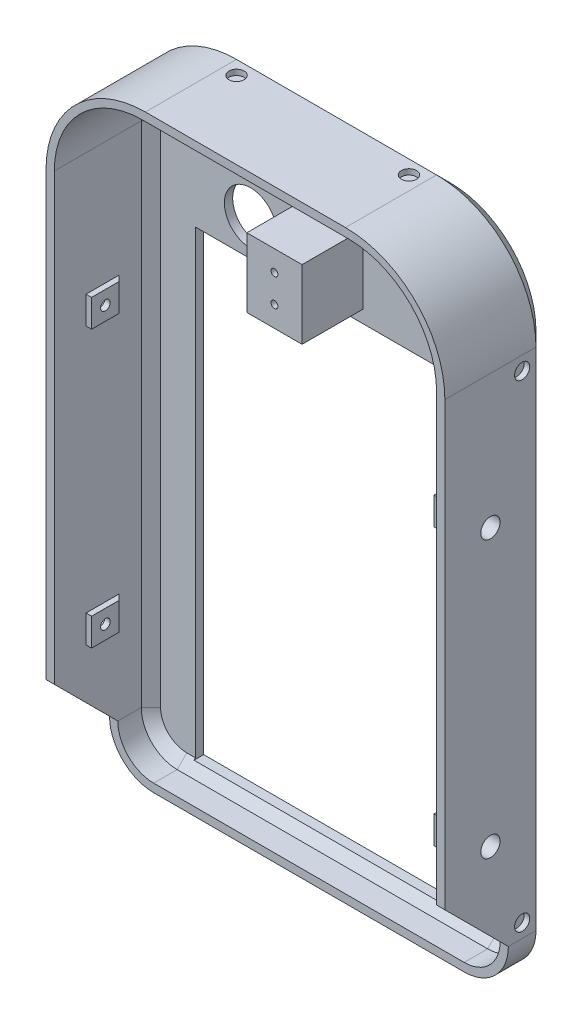
from build123d import *

# Parameters (mm, degrees)
ESQUISSE1_W                  = 20
ESQUISSE1_H                  = 25
BOSS_EXTRU_1_DEPTH           = 22
ESQUISSE2_R                  = 1.25
ENL_V_MAT_EXTRU_1_DEPTH      = 15
ESQUISSE3_W                  = 144.45
ESQUISSE3_H                  = 62
WALL_DEPTH                   = 3
CAMERAS_REACH                = 91.291
ESQUISSE4_R                  = 9.5
SCREEN_DEPTH                 = 3
ESQUISSE5_W                  = 144.45
ESQUISSE5_H                  = 235
ESQUISSE5_W_2                = 138.45
ESQUISSE5_H_2                = 229
BOSS_EXTRU_3_DEPTH           = 35
CONG_1_R                     = 32
CONG_2_R                     = 36
CONG_3_R                     = 13
CONG_4_R                     = 16
CHANFREIN1_SIZE              = 5
CHANFREIN2_SIZE              = 3.5
ENL_V_MAT_EXTRU_9_DEPTH      = 241.631456034
ESQUISSE11_W                 = 12.45
ESQUISSE11_H                 = 10
ESQUISSE11_W_2               = 2
BOSS_EXTRU_5_DEPTH           = 10
CHANFREIN3_SIZE              = 2
CHANFREIN4_SIZE              = 12.45
ENL_V_MAT_EXTRU_5_DEPTH      = 232.686631322
ENL_V_MAT_EXTRU_5_DEPTH_BACK = 232.686631322
ESQUISSE12_R                 = 1.75
ESQUISSE13_R                 = 3.5
ENL_V_MAT_EXTRU_6_DEPTH      = 3
ENL_V_START                  = -13.45
ESQUISSE14_R                 = 3.5
ENL_V_MAT_EXTRU_7_DEPTH      = 13.45
ESQUISSE6_R                  = 2.75
ENL_V_MAT_EXTRU_2_DEPTH      = 2
ESQUISSE7_R                  = 2.75
ENL_V_MAT_EXTRU_3_DEPTH      = 2
ENL_V_START_2                = -2
ESQUISSE8_R                  = 2.75
ENL_V_MAT_EXTRU_4_DEPTH      = 2
ESQUISSE15_R                 = 2.75
ENL_V_MAT_EXTRU_8_DEPTH      = 2


# Some blends are built 0.0001 mm under size
with BuildPart() as part:
    # Esquisse1 → Boss.-Extru.1 (new body)
    with BuildSketch(Plane.XY):
        with Locations((-2.234848485, 0.757575758)):
            Rectangle(ESQUISSE1_W, ESQUISSE1_H)
    extrude(amount=BOSS_EXTRU_1_DEPTH)

    # Esquisse2 → Enlèv. mat.-Extru.1 (cut)
    with BuildSketch(Plane.XY.offset(22)):
        with Locations((-2.234848485, 5.757575758)):
            Circle(ESQUISSE2_R)
        with Locations((-2.234848485, -4.242424242)):
            Circle(ESQUISSE2_R)
    extrude(amount=-ENL_V_MAT_EXTRU_1_DEPTH, mode=Mode.SUBTRACT)

    # Esquisse3 → Wall (add)
    with BuildSketch(Plane(origin=(0, 0, 0), x_dir=(-1, 0, 0), z_dir=(0, 0, -1))):
        with Locations((-0.260151515, 14.757575758)):
            Rectangle(ESQUISSE3_W, ESQUISSE3_H)
    extrude(amount=WALL_DEPTH)

    # Esquisse4 → Cameras (cut, up to next)
    with BuildSketch(Plane(origin=(0, 0, -3), x_dir=(-1, 0, 0), z_dir=(0, 0, -1)), mode=Mode.PRIVATE) as cameras_sk1:
        with Locations((32.869848485, -3.452132942)):
            Circle(ESQUISSE4_R)
    cameras_tool1 = extrude(cameras_sk1.sketch, amount=-CAMERAS_REACH, mode=Mode.PRIVATE) & part.part
    # Esquisse4 → Cameras (cut, up to next)
    with BuildSketch(Plane(origin=(0, 0, -3), x_dir=(-1, 0, 0), z_dir=(0, 0, -1)), mode=Mode.PRIVATE) as cameras_sk2:
        with BuildLine():
            Line((-32.535151515, 39.257575758), (32.464848485, 39.257575758))
            ThreePointArc((32.464848485, 39.257575758), (42.964848485, 28.757575758), (32.464848485, 18.257575758))
            Line((32.464848485, 18.257575758), (-32.535151515, 18.257575758))
            ThreePointArc((-32.535151515, 18.257575758), (-43.035151515, 28.757575758), (-32.535151515, 39.257575758))
        make_face()
    cameras_tool2 = extrude(cameras_sk2.sketch, amount=-CAMERAS_REACH, mode=Mode.PRIVATE) & part.part
    add(cameras_tool1.solids().sort_by_distance((-32.869848, -3.452133, -3))[0], mode=Mode.SUBTRACT)
    add(cameras_tool2.solids().sort_by_distance((0.035152, 28.757576, -3))[0], mode=Mode.SUBTRACT)

    # Esquisse9 → Screen (add)
    with BuildSketch(Plane(origin=(0, 0, -3), x_dir=(-1, 0, 0), z_dir=(0, 0, -1))):
        Polygon((-49.135151515, -183.242424242), (52.864848485, -183.242424242), (52.864848485, -16.242424242), (71.964848485, -16.242424242), (71.964848485, -189.242424242), (-72.485151515, -189.242424242), (-72.485151515, -16.242424242), (-49.135151515, -16.242424242), align=None)
    extrude(amount=-SCREEN_DEPTH)

    # Esquisse5 → Boss.-Extru.3 (add)
    with BuildSketch(Plane.XY):
        with Locations((0.260151515, -71.742424242)):
            Rectangle(ESQUISSE5_W, ESQUISSE5_H)
        with Locations((0.260151515, -71.742424242)):
            Rectangle(ESQUISSE5_W_2, ESQUISSE5_H_2, mode=Mode.SUBTRACT)
    extrude(amount=BOSS_EXTRU_3_DEPTH)

    # Congé1
    cong_1_edges = [part.edges().sort_by_distance(p)[0] for p in [
        (-68.964848485, 42.757575758, 17.5),
        (69.485151515, 42.757575758, 17.5),
    ]]
    fillet(cong_1_edges, radius=CONG_1_R)

    # Congé2
    cong_2_edges = [part.edges().sort_by_distance(p)[0] for p in [
        (-71.964848485, 45.757575758, 16),
        (72.485151515, 45.757575758, 16),
    ]]
    fillet(cong_2_edges, radius=CONG_2_R)

    # Congé3
    cong_3_edges = [part.edges().sort_by_distance(p)[0] for p in [
        (69.485151515, -186.242424242, 17.5),
        (-68.964848485, -186.242424242, 17.5),
    ]]
    fillet(cong_3_edges, radius=CONG_3_R)

    # Congé4
    cong_4_edges = [part.edges().sort_by_distance(p)[0] for p in [
        (72.485151515, -189.242424242, 16),
        (-71.964848485, -189.242424242, 16),
    ]]
    fillet(cong_4_edges, radius=CONG_4_R)

    # Chanfrein1
    chanfrein1_edges = [part.edges().sort_by_distance(p)[0] for p in [
        (0.260151515, 45.757575758, -3),
        (72.485151515, -81.742424242, -3),
        (61.940995638, 35.21341988, -3),
        (-61.420692608, 35.21341988, -3),
        (0.260151515, -189.242424242, -3),
        (-71.964848485, -81.742424242, -3),
        (67.798860014, -184.556132741, -3),
        (-67.278556984, -184.556132741, -3),
    ]]
    chamfer(chanfrein1_edges, length=CHANFREIN1_SIZE)

    # Chanfrein2
    # the kernel refuses this chamfer: 3.5 mm, written as the material it adds along each edge
    with BuildSketch(Plane(origin=(-68.964848485, 10.757575758, 0), x_dir=(-0.02749587661058612, 0, 0.9996219169112968), z_dir=(0, -1, 0)), Plane(origin=(69.485151515, -173.242424242, 0), x_dir=(0.02749587661058612, 0, 0.9996219169112968), z_dir=(0, 1, 0))) as chanfrein2_piece_1:
        Polygon((CHANFREIN2_SIZE * 0.999621916911, -CHANFREIN2_SIZE * 0.0274958766106), (-CHANFREIN2_SIZE * 0.0274958766106, -CHANFREIN2_SIZE * 0.999621916911), (0, 0), align=None)
    extrude(amount=184)
    with BuildSketch(Plane(origin=(-36.964848485, 10.757575758, 0), x_dir=(0, 1, 0), z_dir=(1, 0, 0))) as chanfrein2_piece_2:
        Polygon((32, CHANFREIN2_SIZE), (32 - CHANFREIN2_SIZE, 0), (32, 0), align=None)
    revolve(axis=Axis((-36.964848485, 10.757575758, 0), (0, 0, 1)), revolution_arc=90)
    with BuildSketch(Plane(origin=(37.485151515, 42.757575758, 0), x_dir=(0, 0.02749587661058612, 0.9996219169112968), z_dir=(-1, 0, 0))) as chanfrein2_piece_3:
        Polygon((CHANFREIN2_SIZE * 0.999621916911, -CHANFREIN2_SIZE * 0.0274958766106), (-CHANFREIN2_SIZE * 0.0274958766106, -CHANFREIN2_SIZE * 0.999621916911), (0, 0), align=None)
    extrude(amount=74.45)
    with BuildSketch(Plane(origin=(37.485151515, 10.757575758, 0), x_dir=(1, 0, 0), z_dir=(0, -1, 0))) as chanfrein2_piece_4:
        Polygon((32, CHANFREIN2_SIZE), (32 - CHANFREIN2_SIZE, 0), (32, 0), align=None)
    revolve(axis=Axis((37.485151515, 10.757575758, 0), (0, 0, 1)), revolution_arc=90)
    with BuildSketch(Plane(origin=(-55.964848485, -173.242424242, 0), x_dir=(-1, 0, 0), z_dir=(0, 1, 0))) as chanfrein2_piece_5:
        Polygon((13, CHANFREIN2_SIZE), (13 - CHANFREIN2_SIZE, 0), (13, 0), align=None)
    revolve(axis=Axis((-55.964848485, -173.242424242, 0), (0, 0, 1)), revolution_arc=90)
    with BuildSketch(Plane(origin=(-55.964848485, -186.242424242, 0), x_dir=(0, -0.027495876610590064, 0.9996219169112966), z_dir=(1, 0, 0))) as chanfrein2_piece_6_section:
        Polygon((CHANFREIN2_SIZE * 0.999621916911, -CHANFREIN2_SIZE * 0.0274958766106), (-CHANFREIN2_SIZE * 0.0274958766106, -CHANFREIN2_SIZE * 0.999621916911), (0, 0), align=None)
    chanfrein2_piece_6 = extrude(amount=112.45, mode=Mode.PRIVATE)
    chanfrein2_piece_6 = split(chanfrein2_piece_6, bisect_by=Plane(origin=(-53.646167158, -183.242424242, 1.694983129), z_dir=(0, -1, 0)), keep=Keep.TOP, mode=Mode.PRIVATE)
    add(chanfrein2_piece_6)
    with BuildSketch(Plane(origin=(-55.964848485, -186.242424242, 0), x_dir=(0, -0.027495876610590064, 0.9996219169112966), z_dir=(1, 0, 0))) as chanfrein2_piece_7_section:
        Polygon((CHANFREIN2_SIZE * 0.999621916911, -CHANFREIN2_SIZE * 0.0274958766106), (-CHANFREIN2_SIZE * 0.0274958766106, -CHANFREIN2_SIZE * 0.999621916911), (0, 0), align=None)
    chanfrein2_piece_7 = extrude(amount=112.45, mode=Mode.PRIVATE)
    chanfrein2_piece_7 = split(chanfrein2_piece_7, bisect_by=Plane(origin=(-52.864848485, -183.075757576, 0.166666667), z_dir=(-1, 0, 0)), keep=Keep.TOP, mode=Mode.PRIVATE)
    add(chanfrein2_piece_7)
    with BuildSketch(Plane(origin=(-55.964848485, -186.242424242, 0), x_dir=(0, -0.027495876610590064, 0.9996219169112966), z_dir=(1, 0, 0))) as chanfrein2_piece_8_section:
        Polygon((CHANFREIN2_SIZE * 0.999621916911, -CHANFREIN2_SIZE * 0.0274958766106), (-CHANFREIN2_SIZE * 0.0274958766106, -CHANFREIN2_SIZE * 0.999621916911), (0, 0), align=None)
    chanfrein2_piece_8 = extrude(amount=112.45, mode=Mode.PRIVATE)
    chanfrein2_piece_8 = split(chanfrein2_piece_8, bisect_by=Plane(origin=(49.135151515, -183.075757576, 0.166666667), z_dir=(1, 0, 0)), keep=Keep.TOP, mode=Mode.PRIVATE)
    add(chanfrein2_piece_8)
    with BuildSketch(Plane(origin=(56.485151515, -173.242424242, 0), x_dir=(0, -1, 0), z_dir=(-1, 0, 0))) as chanfrein2_piece_9:
        Polygon((13, CHANFREIN2_SIZE), (13 - CHANFREIN2_SIZE, 0), (13, 0), align=None)
    revolve(axis=Axis((56.485151515, -173.242424242, 0), (0, 0, 1)), revolution_arc=90)

    # Esquisse16 → Enlèv. mat.-Extru.9 (cut, through all)
    with BuildSketch(Plane(origin=(72.485151515, 0, 0), x_dir=(0, 0, -1), z_dir=(1, 0, 0))):
        Polygon((-35, -150.242424242), (-12, -173.242424242), (-12, -189.242424242), (-35, -189.242424242), align=None)
    extrude(amount=-ENL_V_MAT_EXTRU_9_DEPTH, mode=Mode.SUBTRACT)

    # Esquisse11 → Boss.-Extru.5 (add)
    with BuildSketch(Plane.XY.offset(13.5)):
        with Locations((63.260151515, -138.631356632)):
            Rectangle(ESQUISSE11_W, ESQUISSE11_H)
        with Locations((63.260151515, -38.631356632)):
            Rectangle(ESQUISSE11_W, ESQUISSE11_H)
        with Locations((-67.964848485, -138.631356632)):
            Rectangle(ESQUISSE11_W_2, ESQUISSE11_H)
        with Locations((-67.964848485, -38.631356632)):
            Rectangle(ESQUISSE11_W_2, ESQUISSE11_H)
    extrude(amount=BOSS_EXTRU_5_DEPTH)

    # Chanfrein3
    chanfrein3_edges = [part.edges().sort_by_distance(p)[0] for p in [
        (-68.964848485, -38.631356632, 13.5),
        (-68.964848485, -138.631356632, 13.5),
    ]]
    chamfer(chanfrein3_edges, length=CHANFREIN3_SIZE - 0.0001)  # a hair under: the kernel refuses the full size

    # Chanfrein4
    # the kernel refuses this chamfer: 12.45 mm, written as the material it adds along each edge
    with BuildSketch(Plane(origin=(69.485151515, -43.631356632, 13.5), x_dir=(0.027495876610586834, 0, -0.9996219169112968), z_dir=(0, 1, 0))) as chanfrein4_piece_1_section:
        Polygon((CHANFREIN4_SIZE * 0.999621916911, CHANFREIN4_SIZE * 0.0274958766106), (-CHANFREIN4_SIZE * 0.0274958766106, CHANFREIN4_SIZE * 0.999621916911), (0, 0), align=None)
    chanfrein4_piece_1 = extrude(amount=10, mode=Mode.PRIVATE)
    chanfrein4_piece_1 = split(chanfrein4_piece_1, bisect_by=Plane(origin=(57.035151515, -38.631356632, 9.386468279), z_dir=(1, 0, 0)), keep=Keep.TOP, mode=Mode.PRIVATE)
    add(chanfrein4_piece_1)
    with BuildSketch(Plane(origin=(69.485151515, -133.631356632, 13.5), x_dir=(0.027495876610586834, 0, -0.9996219169112968), z_dir=(0, -1, 0))) as chanfrein4_piece_2_section:
        Polygon((CHANFREIN4_SIZE * 0.999621916911, -CHANFREIN4_SIZE * 0.0274958766106), (-CHANFREIN4_SIZE * 0.0274958766106, -CHANFREIN4_SIZE * 0.999621916911), (0, 0), align=None)
    chanfrein4_piece_2 = extrude(amount=10, mode=Mode.PRIVATE)
    chanfrein4_piece_2 = split(chanfrein4_piece_2, bisect_by=Plane(origin=(57.035151515, -138.631356632, 9.386468279), z_dir=(1, 0, 0)), keep=Keep.TOP, mode=Mode.PRIVATE)
    add(chanfrein4_piece_2)

    # Esquisse12 → Enlèv. mat.-Extru.5 (cut, two sides: drawn at the far end of the back side and taken through both)
    with BuildSketch(Plane.ZY.offset(-57.035151515).offset(-ENL_V_MAT_EXTRU_5_DEPTH_BACK)):
        with Locations((18.5, -38.631356632)):
            Circle(ESQUISSE12_R)
        with Locations((18.5, -138.631356632)):
            Circle(ESQUISSE12_R)
    extrude(amount=ENL_V_MAT_EXTRU_5_DEPTH + ENL_V_MAT_EXTRU_5_DEPTH_BACK, mode=Mode.SUBTRACT)

    # Esquisse13 → Enlèv. mat.-Extru.6 (cut)
    with BuildSketch(Plane.ZY.offset(71.964848485)):
        with Locations((18.5, -38.631356632)):
            Circle(ESQUISSE13_R)
        with Locations((18.5, -138.631356632)):
            Circle(ESQUISSE13_R)
    extrude(amount=-ENL_V_MAT_EXTRU_6_DEPTH, mode=Mode.SUBTRACT)

    # Esquisse14 → Enlèv. mat.-Extru.7 (cut)
    with BuildSketch(Plane(origin=(72.485151515, 0, 0), x_dir=(0, 0, -1), z_dir=(1, 0, 0)).offset(ENL_V_START)):
        with Locations(Location((-18.5, -138.631356632, 0), (0, 0, 180))):
            Circle(ESQUISSE14_R)
        with Locations(Location((-18.5, -38.631356632, 0), (0, 0, 180))):
            Circle(ESQUISSE14_R)
    extrude(amount=ENL_V_MAT_EXTRU_7_DEPTH, mode=Mode.SUBTRACT)

    # Esquisse6 → Enlèv. mat.-Extru.2 (cut)
    with BuildSketch(Plane(origin=(0, 45.757575758, 0), x_dir=(1, 0, 0), z_dir=(0, 1, 0))):
        with Locations(Location((31.485151515, -7, 0), (0, 0, 180))):
            Circle(ESQUISSE6_R)
        with Locations(Location((-30.964848485, -7, 0), (0, 0, 180))):
            Circle(ESQUISSE6_R)
    extrude(amount=-ENL_V_MAT_EXTRU_2_DEPTH, mode=Mode.SUBTRACT)

    # Esquisse7 → Enlèv. mat.-Extru.3 (cut)
    with BuildSketch(Plane(origin=(72.485151515, 0, 0), x_dir=(0, 0, -1), z_dir=(1, 0, 0))):
        with Locations(Location((-7, 4.757575758, 0), (0, 0, 90))):
            Circle(ESQUISSE7_R)
        with Locations(Location((-7, -168.242424242, 0), (0, 0, 90))):
            Circle(ESQUISSE7_R)
    extrude(amount=-ENL_V_MAT_EXTRU_3_DEPTH, mode=Mode.SUBTRACT)

    # Esquisse8 → Enlèv. mat.-Extru.4 (cut)
    with BuildSketch(Plane.ZY.offset(71.964848485).offset(ENL_V_START_2)):
        with Locations(Location((7, 4.757575758, 0), (0, 0, 90))):
            Circle(ESQUISSE8_R)
        with Locations(Location((7, -168.242424242, 0), (0, 0, 90))):
            Circle(ESQUISSE8_R)
    extrude(amount=ENL_V_MAT_EXTRU_4_DEPTH, mode=Mode.SUBTRACT)

    # Esquisse15 → Enlèv. mat.-Extru.8 (cut)
    with BuildSketch(Plane.XZ.offset(189.242424242).offset(ENL_V_START_2)):
        with Locations(Location((-30.964848485, 7, 0), (0, 0, 180))):
            Circle(ESQUISSE15_R)
        with Locations(Location((31.485151515, 7, 0), (0, 0, 180))):
            Circle(ESQUISSE15_R)
    extrude(amount=ENL_V_MAT_EXTRU_8_DEPTH, mode=Mode.SUBTRACT)


solid = part.part
